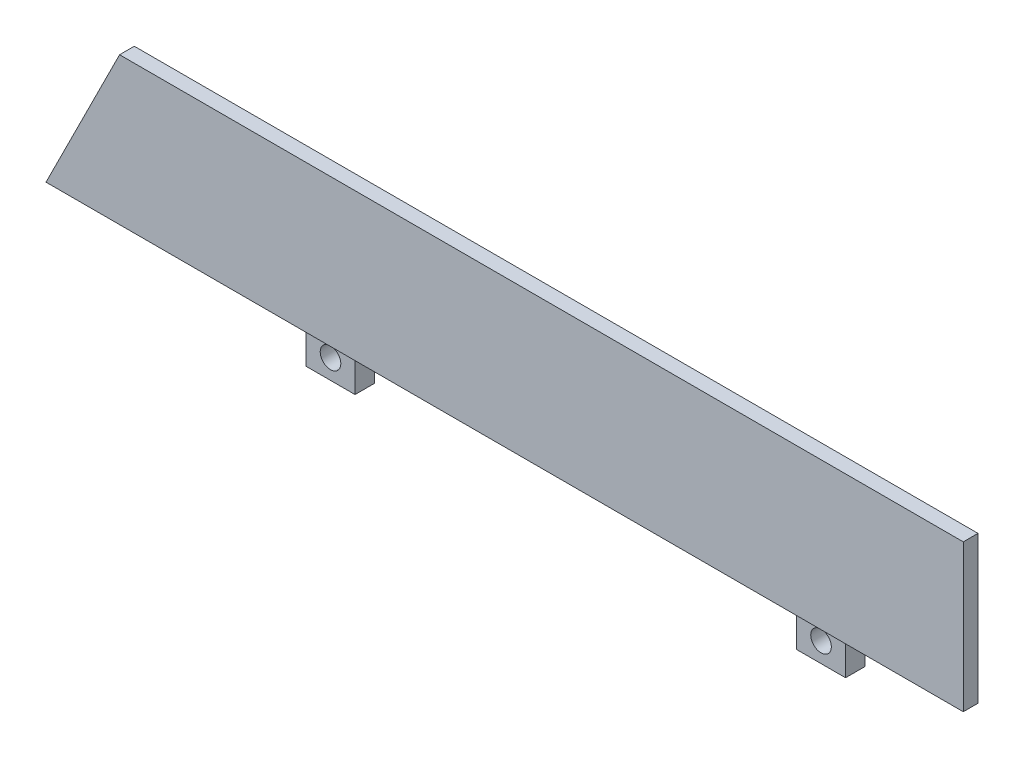
from build123d import *

# Parameters (mm, degrees)
DODANIE_WYCI_GNI_CIE1_DEPTH       = 3
SZKIC2_W                          = 10
SZKIC2_H                          = 14
SZKIC2_R                          = 2.1
DODANIE_WYCI_GNI_CIE2_DEPTH       = 4
SFAZOWANIE1_SIZE                  = 4
SZYK_LINIOWY1_COUNT               = 2
SZYK_LINIOWY1_PITCH               = 100
SFAZOWANIE1_OF_SZYK_LINIOWY1_SIZE = 4


with BuildPart() as part:
    # Szkic1 → Dodanie-wyciągnięcie1 (new body)
    with BuildSketch(Plane.XY):
        Polygon((0, 0), (187, 0), (187, 30), (15, 30), align=None)
    extrude(amount=DODANIE_WYCI_GNI_CIE1_DEPTH)

    # Szkic2 → Dodanie-wyciągnięcie2 (add)
    with BuildSketch(Plane(origin=(0, 0, 0), x_dir=(-1, 0, 0), z_dir=(0, 0, -1))):
        with Locations((-155, -2)):
            Rectangle(SZKIC2_W, SZKIC2_H)
        with Locations((-155, -5)):
            Circle(SZKIC2_R, mode=Mode.SUBTRACT)
    dodanie_wyci_gni_cie2 = extrude(amount=DODANIE_WYCI_GNI_CIE2_DEPTH)

    # Sfazowanie1
    sfazowanie1_edges = [part.edges().sort_by_distance(p)[0] for p in [
        (160, 2.5, 0),
        (155, 5, 0),
        (150, 2.5, 0),
    ]]
    chamfer(sfazowanie1_edges, length=SFAZOWANIE1_SIZE - 0.0001)  # a hair under: the kernel refuses the full size

    # Szyk liniowy1: Dodanie-wyciągnięcie2 ×2
    with Locations(*[(-i * SZYK_LINIOWY1_PITCH, 0, 0) for i in range(1, SZYK_LINIOWY1_COUNT)]):
        add(dodanie_wyci_gni_cie2)

    # Sfazowanie1 of Szyk liniowy1
    sfazowanie1_of_szyk_liniowy1_edges = [part.edges().sort_by_distance(p)[0] for p in [
        (60, 2.5, 0),
        (55, 5, 0),
        (50, 2.5, 0),
    ]]
    chamfer(sfazowanie1_of_szyk_liniowy1_edges, length=SFAZOWANIE1_OF_SZYK_LINIOWY1_SIZE - 0.0001)  # a hair under: the kernel refuses the full size


solid = part.part
